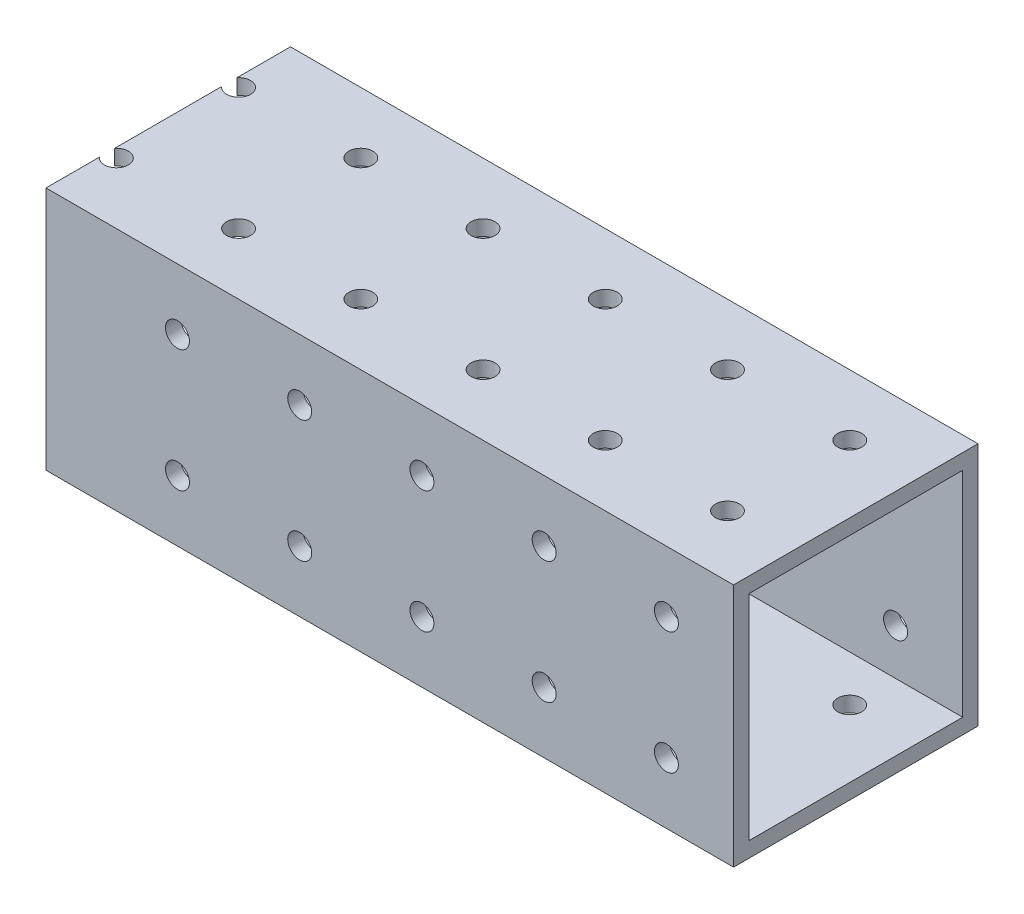
from build123d import *

# Parameters (mm, degrees)
SKETCH1_W           = 50.8
SKETCH1_H           = 50.8
BOSS_EXTRUDE1_DEPTH = 142.875
SHELL1_T            = -3.175
SKETCH2_R           = 2.4892
CUT_EXTRUDE1_DEPTH  = 160.920435295
SKETCH3_R           = 2.4892
CUT_EXTRUDE2_DEPTH  = 160.920435295
LPATTERN1_COUNT     = 6
LPATTERN1_PITCH     = 25.4


with BuildPart() as part:
    # Sketch1 → Boss-Extrude1 (new body)
    with BuildSketch(Plane(origin=(0, 0, 0), x_dir=(0, 0, -1), z_dir=(1, 0, 0))):
        with Locations((25.4, 25.4)):
            Rectangle(SKETCH1_W, SKETCH1_H)
    extrude(amount=BOSS_EXTRUDE1_DEPTH)

    # Shell1
    shell1_openings = [part.faces().sort_by_distance(p)[0] for p in [
        (0, 25.4, -25.4),
        (142.875, 25.4, -25.4),
    ]]
    offset(amount=SHELL1_T, openings=shell1_openings, kind=Kind.INTERSECTION)

    # Sketch2 → Cut-Extrude1 (cut, through all)
    with BuildSketch(Plane(origin=(0, 0, -50.8), x_dir=(-1, 0, 0), z_dir=(0, 0, -1))):
        with Locations((-128.920834122, 38.1)):
            Circle(SKETCH2_R)
        with Locations((-103.520834122, 38.1)):
            Circle(SKETCH2_R)
        with Locations((-78.120834122, 38.1)):
            Circle(SKETCH2_R)
        with Locations((-52.720834122, 38.1)):
            Circle(SKETCH2_R)
        with Locations((-27.320834122, 38.1)):
            Circle(SKETCH2_R)
        with Locations((-27.320834122, 12.7)):
            Circle(SKETCH2_R)
        with Locations((-52.720834122, 12.7)):
            Circle(SKETCH2_R)
        with Locations((-78.120834122, 12.7)):
            Circle(SKETCH2_R)
        with Locations((-103.520834122, 12.7)):
            Circle(SKETCH2_R)
        with Locations((-128.920834122, 12.7)):
            Circle(SKETCH2_R)
    extrude(amount=-CUT_EXTRUDE1_DEPTH, mode=Mode.SUBTRACT)

    # Sketch3 → Cut-Extrude2 (cut, through all)
    with BuildSketch(Plane.XZ):
        with Locations((128.920834122, -12.7)):
            Circle(SKETCH3_R)
        with Locations((128.920834122, -38.1)):
            Circle(SKETCH3_R)
    cut_extrude2 = extrude(amount=-CUT_EXTRUDE2_DEPTH, mode=Mode.SUBTRACT)

    # LPattern1: Cut-Extrude2 ×6
    with Locations(*[(-i * LPATTERN1_PITCH, 0, 0) for i in range(1, LPATTERN1_COUNT)]):
        add(cut_extrude2, mode=Mode.SUBTRACT)


solid = part.part
